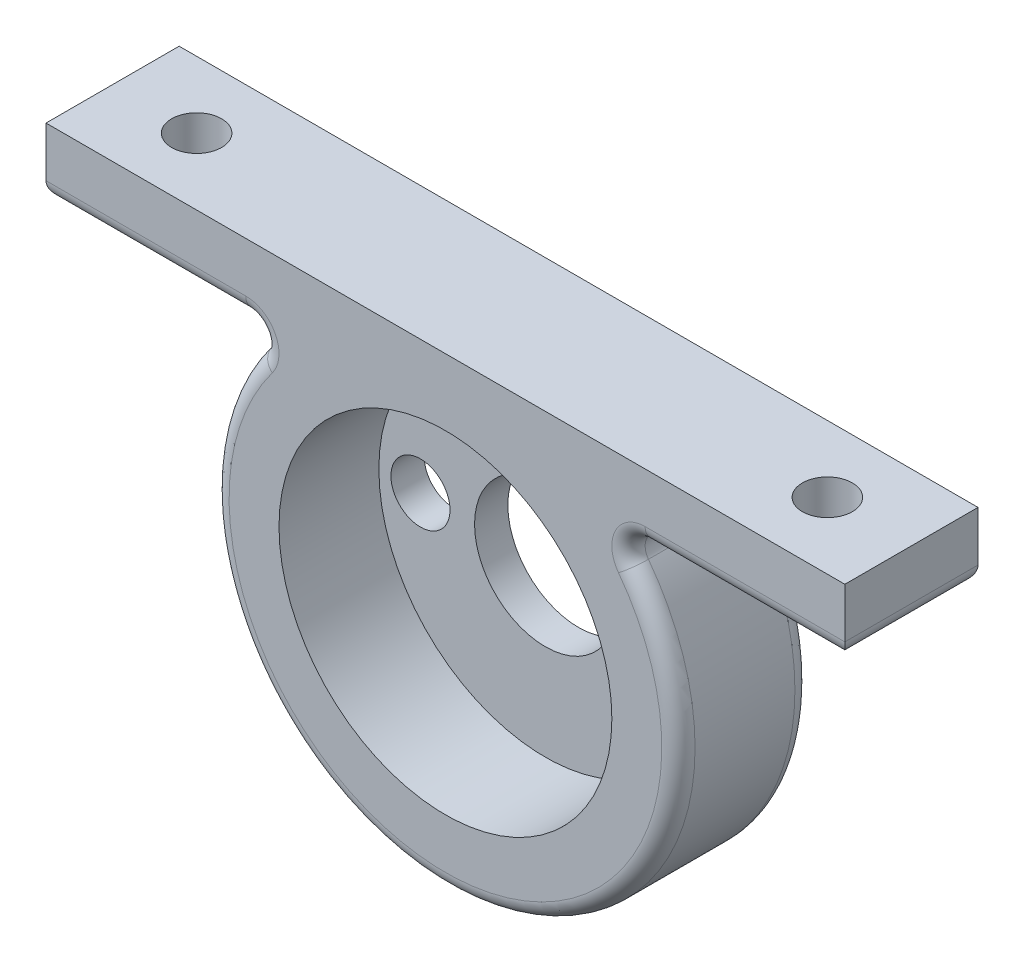
from build123d import *

# Parameters (mm, degrees)
SALIENTE_EXTRUIR1_DEPTH = 8
REDONDEO1_R             = 1
CROQUIS2_R              = 1.5
CORTAR_EXTRUIR1_DEPTH   = 35.871191617
CROQUIS3_R              = 10
CORTAR_EXTRUIR2_DEPTH   = 6
CROQUIS4_R              = 4.25
CROQUIS4_R_2            = 1.775
CORTAR_EXTRUIR3_DEPTH   = 29.913664638


with BuildPart() as part:
    # Croquis1 → Saliente-Extruir1 (new body)
    with BuildSketch(Plane.XY):
        with BuildLine():
            Line((0, 14), (24, 14))
            Line((24, 14), (24, 10))
            Line((24, 10), (9.797958971, 10))
            ThreePointArc((9.797958971, 10), (0, -14), (-9.797958971, 10))
            Line((-9.797958971, 10), (-24, 10))
            Line((-24, 10), (-24, 14))
            Line((-24, 14), (0, 14))
        make_face()
    extrude(amount=SALIENTE_EXTRUIR1_DEPTH)

    # Redondeo1
    redondeo1_edges = [part.edges().sort_by_distance(p)[0] for p in [
        (-16.898979486, 10, 8),
        (-16.898979486, 10, 0),
        (16.898979486, 10, 8),
        (16.898979486, 10, 0),
        (-9.797958971, 10, 4),
        (0, -14, 8),
        (9.797958971, 10, 4),
        (0, -14, 0),
        (24, 10, 4),
        (-24, 10, 4),
    ]]
    fillet(redondeo1_edges, radius=REDONDEO1_R)

    # Croquis2 → Cortar-Extruir1 (cut, through all)
    with BuildSketch(Plane.XZ.offset(-10)):
        with Locations((-18.949489743, 4)):
            Circle(CROQUIS2_R)
        with Locations((18.949489743, 4)):
            Circle(CROQUIS2_R)
    extrude(amount=-CORTAR_EXTRUIR1_DEPTH, mode=Mode.SUBTRACT)

    # Croquis3 → Cortar-Extruir2 (cut)
    with BuildSketch(Plane.XY.offset(8)):
        Circle(CROQUIS3_R)
    extrude(amount=-CORTAR_EXTRUIR2_DEPTH, mode=Mode.SUBTRACT)

    # Croquis4 → Cortar-Extruir3 (cut, through all)
    with BuildSketch(Plane(origin=(0, 0, 0), x_dir=(-1, 0, 0), z_dir=(0, 0, -1))):
        Circle(CROQUIS4_R)
        with Locations((7.5, 0)):
            Circle(CROQUIS4_R_2)
        with Locations((-7.5, 0)):
            Circle(CROQUIS4_R_2)
    extrude(amount=-CORTAR_EXTRUIR3_DEPTH, mode=Mode.SUBTRACT)


solid = part.part
